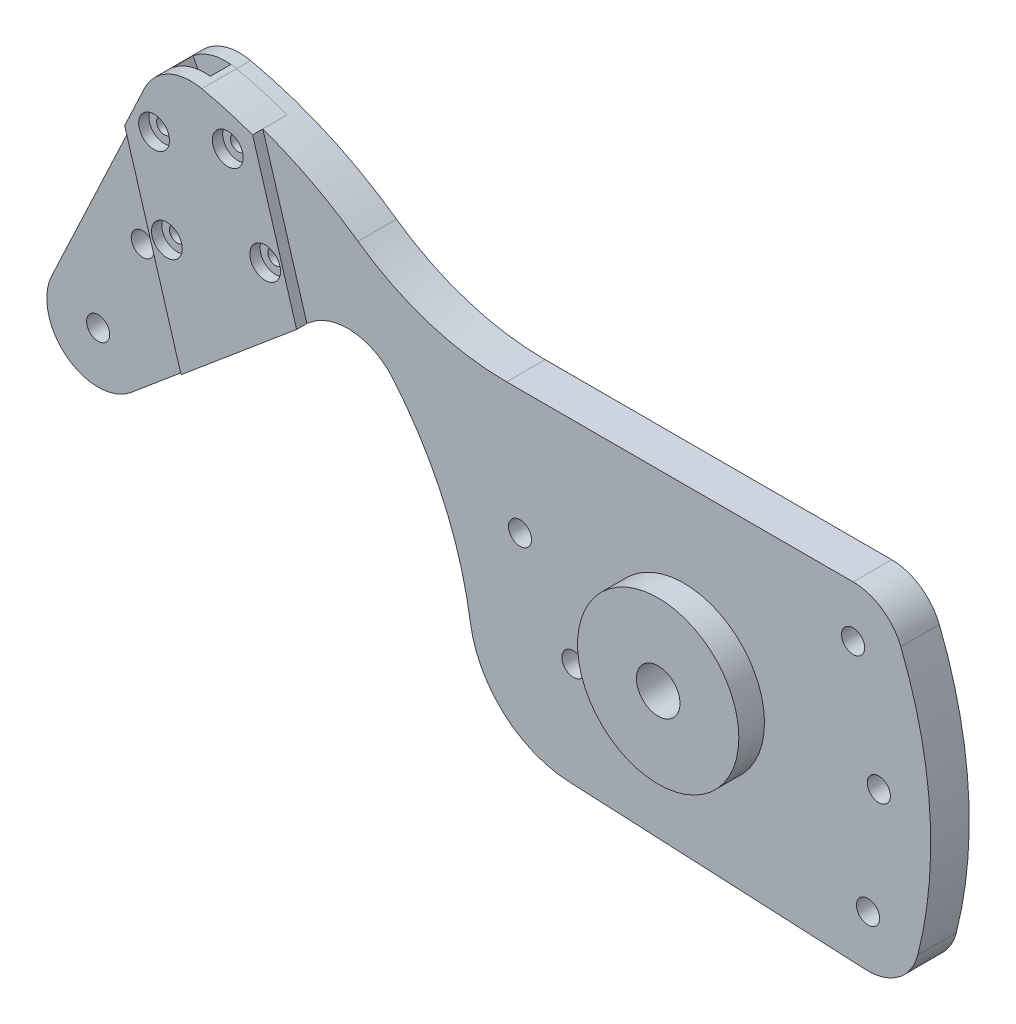
from build123d import *

# Parameters (mm, degrees)
SKETCH1_R              = 2.25
SKETCH1_R_2            = 4.25
BOSS_EXTRUDE1_DEPTH    = 4.75
CUT_EXTRUDE1_DEPTH     = 2
SKETCH4_R              = 1.5
CUT_EXTRUDE2_DEPTH     = 136.849086626
SKETCH5_R              = 3
CUT_EXTRUDE3_DEPTH     = 2
SPLIT3_SURFACE_1_BACK  = 193.818
SPLIT3_SURFACE_1_DEPTH = 387.636
SPLIT3_SURFACE_2_BACK  = 193.818
SPLIT3_SURFACE_2_DEPTH = 387.636
SKETCH6_R              = 15.710018396
CUT_EXTRUDE4_DEPTH     = 2
SKETCH7_R              = 15.710018396
SKETCH7_R_2            = 4.25
BOSS_EXTRUDE2_DEPTH    = 3


with BuildPart() as part:
    # Sketch1 → Boss-Extrude1 (new, symmetric)
    with BuildSketch(Plane.XY):
        with BuildLine():
            Line((-22.500230832, -28.983987123), (35.398437983, -31.788291003))
            ThreePointArc((35.398437983, -31.788291003), (41.825152283, -29.842482755), (45.572267137, -24.270413418))
            ThreePointArc((45.572267137, -24.270413418), (47.922199842, 1.185089324), (42.266415188, 26.115330067))
            ThreePointArc((42.266415188, 26.115330067), (38.587871094, 30.681102), (32.982217728, 32.4))
            Line((32.982217728, 32.4), (-34.53815208, 32.4))
            ThreePointArc((-34.53815208, 32.4), (-49.730929753, 34.764094355), (-63.487021029, 41.632819737))
            ThreePointArc((-63.487021029, 41.632819737), (-77.067258547, 49.344582351), (-91.918742124, 54.174444589))
            ThreePointArc((-91.918742124, 54.174444589), (-98.466295495, 53.366674665), (-103.085929893, 48.656905518))
            Line((-103.085929893, 48.656905518), (-123.167077545, 5.955614534))
            ThreePointArc((-123.167077545, 5.955614534), (-120.218280198, -6.2236308), (-107.689906175, -5.960444431))
            Line((-107.689906175, -5.960444431), (-72.864818345, 23.261273923))
            ThreePointArc((-72.864818345, 23.261273923), (-64.470178387, 25.908093735), (-56.662687309, 21.843771132))
            ThreePointArc((-56.662687309, 21.843771132), (-46.809939593, 6.135423294), (-41.608278072, -11.662653759))
            ThreePointArc((-41.608278072, -11.662653759), (-35.156858245, -23.745961099), (-22.500230832, -28.983987123))
        make_face()
        with Locations((35.882217728, -21.8)):
            Circle(SKETCH1_R, mode=Mode.SUBTRACT)
        with Locations((-21.517782272, -8.7)):
            Circle(SKETCH1_R, mode=Mode.SUBTRACT)
        Circle(SKETCH1_R_2, mode=Mode.SUBTRACT)
        with Locations((-31.917782272, 8.2)):
            Circle(SKETCH1_R, mode=Mode.SUBTRACT)
        with Locations((37.982217728, -0.1)):
            Circle(SKETCH1_R, mode=Mode.SUBTRACT)
        with Locations((32.982217728, 22.4)):
            Circle(SKETCH1_R, mode=Mode.SUBTRACT)
        with Locations((-105.417782272, 20.2)):
            Circle(SKETCH1_R, mode=Mode.SUBTRACT)
        with Locations((-114.117782272, 1.7)):
            Circle(SKETCH1_R, mode=Mode.SUBTRACT)
    extrude(amount=BOSS_EXTRUDE1_DEPTH, both=True)

    # Sketch2 → Cut-Extrude1 (cut, symmetric)
    with BuildSketch(Plane.XY):
        with BuildLine():
            Line((-78.227129447, 18.761760655), (-92.084556702, 44.987885053))
            Line((-92.084556702, 44.987885053), (-93.002217677, 54.347646176))
            ThreePointArc((-93.002217677, 54.347646176), (-96.914482214, 53.978242129), (-100.382341665, 52.129939126))
            Line((-100.382341665, 52.129939126), (-95.988712538, 43.814696915))
            Line((-95.988712538, 43.814696915), (-92.369017313, 6.895307763))
            Line((-92.369017313, 6.895307763), (-78.227129447, 18.761760655))
        make_face()
    extrude(amount=CUT_EXTRUDE1_DEPTH, both=True, mode=Mode.SUBTRACT)

    # Sketch4 → Cut-Extrude2 (cut, through all)
    with BuildSketch(Plane.XY.offset(4.75)):
        with Locations((-98.721244854, 25.242626445)):
            Circle(SKETCH4_R)
        with Locations((-101.219347979, 42.242905289)):
            Circle(SKETCH4_R)
        with Locations((-86.853921262, 46.55967668)):
            Circle(SKETCH4_R)
        with Locations((-79.567342565, 30.998321633)):
            Circle(SKETCH4_R)
    extrude(amount=-CUT_EXTRUDE2_DEPTH, mode=Mode.SUBTRACT)

    # Sketch5 → Cut-Extrude3 (cut)
    with BuildSketch(Plane.XY.offset(4.75)):
        with Locations((-101.219347979, 42.242905289)):
            Circle(SKETCH5_R)
        with Locations((-86.853921262, 46.55967668)):
            Circle(SKETCH5_R)
        with Locations((-79.567342565, 30.998321633)):
            Circle(SKETCH5_R)
        with Locations((-98.721244854, 25.242626445)):
            Circle(SKETCH5_R)
    extrude(amount=-CUT_EXTRUDE3_DEPTH, mode=Mode.SUBTRACT)


with BuildPart() as body_2:
    # Split3: the piece behind the surface
    add(part.part)
    # Split3 surface: a surface, the sketch's curves swept straight by 387.636 mm
    with BuildLine(Plane(origin=(-20.02556284, 66.641415389, 0), x_dir=(0.9576951144500195, 0.2877847594271872, 0), z_dir=(-0.2877847594271872, 0.9576951144500195, 0)).offset(-SPLIT3_SURFACE_1_BACK), mode=Mode.PRIVATE) as split3_surface_1_path:
        Line((-63.780410711, -4.75), (-63.780410711, 2))
        Line((-63.780410711, 2), (-90.780410711, 2))
        Line((-90.780410711, 2), (-90.780410711, -4.75))
    split3_surface_1 = Shell.extrude(split3_surface_1_path.wire(), (-0.287784759 * SPLIT3_SURFACE_1_DEPTH, 0.957695114 * SPLIT3_SURFACE_1_DEPTH, 0 * SPLIT3_SURFACE_1_DEPTH))
    split(bisect_by=split3_surface_1, keep=Keep.BOTTOM)

    # Sketch6 → Cut-Extrude4 (cut)
    # profile 1 of 2: a face of its own
    with BuildSketch(Plane.XY.offset(4.75)):
        with BuildLine():
            Line((-95.957666069, 3.884073915), (-106.945535827, 40.449697498))
            Line((-106.945535827, 40.449697498), (-123.167077545, 5.955614534))
            ThreePointArc((-123.167077545, 5.955614534), (-120.218280198, -6.2236308), (-107.689906175, -5.960444431))
            Line((-107.689906175, -5.960444431), (-95.957666069, 3.884073915))
        make_face()
    # profile 2 of 2: a face of its own
    with BuildSketch(Plane.XY.offset(4.75)):
        with BuildLine():
            Line((-82.022097036, 51.329163249), (-73.442190431, 22.776801219))
            Line((-73.442190431, 22.776801219), (-72.864818345, 23.261273923))
            ThreePointArc((-72.864818345, 23.261273923), (-64.470178387, 25.908093735), (-56.662687309, 21.843771132))
            ThreePointArc((-56.662687309, 21.843771132), (-46.809939593, 6.135423294), (-41.608278072, -11.662653759))
            ThreePointArc((-41.608278072, -11.662653759), (-35.156858245, -23.745961099), (-22.500230832, -28.983987123))
            Line((-22.500230832, -28.983987123), (35.398437983, -31.788291003))
            ThreePointArc((35.398437983, -31.788291003), (41.825152283, -29.842482755), (45.572267137, -24.270413418))
            ThreePointArc((45.572267137, -24.270413418), (47.922199842, 1.185089324), (42.266415188, 26.115330067))
            ThreePointArc((42.266415188, 26.115330067), (38.587871094, 30.681102), (32.982217728, 32.4))
            Line((32.982217728, 32.4), (-34.53815208, 32.4))
            ThreePointArc((-34.53815208, 32.4), (-49.730929753, 34.764094355), (-63.487021029, 41.632819737))
            ThreePointArc((-63.487021029, 41.632819737), (-72.425615765, 47.109784033), (-82.022097036, 51.329163249))
        make_face()
        Circle(SKETCH6_R, mode=Mode.SUBTRACT)
    extrude(amount=-CUT_EXTRUDE4_DEPTH, mode=Mode.SUBTRACT)

    # Sketch7 → Boss-Extrude2 (add)
    with BuildSketch(Plane.XY.offset(4.75)):
        Circle(SKETCH7_R)
        Circle(SKETCH7_R_2, mode=Mode.SUBTRACT)
    extrude(amount=BOSS_EXTRUDE2_DEPTH)


with BuildPart() as part_1:
    add(part.part)

    # Split3: split by a surface, the side it looks to stays
    # Split3 surface: a surface, the sketch's curves swept straight by 387.636 mm
    with BuildLine(Plane(origin=(-20.02556284, 66.641415389, 0), x_dir=(0.9576951144500195, 0.2877847594271872, 0), z_dir=(-0.2877847594271872, 0.9576951144500195, 0)).offset(-SPLIT3_SURFACE_2_BACK), mode=Mode.PRIVATE) as split3_surface_2_path:
        Line((-63.780410711, -4.75), (-63.780410711, 2))
        Line((-63.780410711, 2), (-90.780410711, 2))
        Line((-90.780410711, 2), (-90.780410711, -4.75))
    split3_surface_2 = Shell.extrude(split3_surface_2_path.wire(), (-0.287784759 * SPLIT3_SURFACE_2_DEPTH, 0.957695114 * SPLIT3_SURFACE_2_DEPTH, 0 * SPLIT3_SURFACE_2_DEPTH))
    split(bisect_by=split3_surface_2, keep=Keep.TOP)


solid = Compound([body_2.part, part_1.part])
